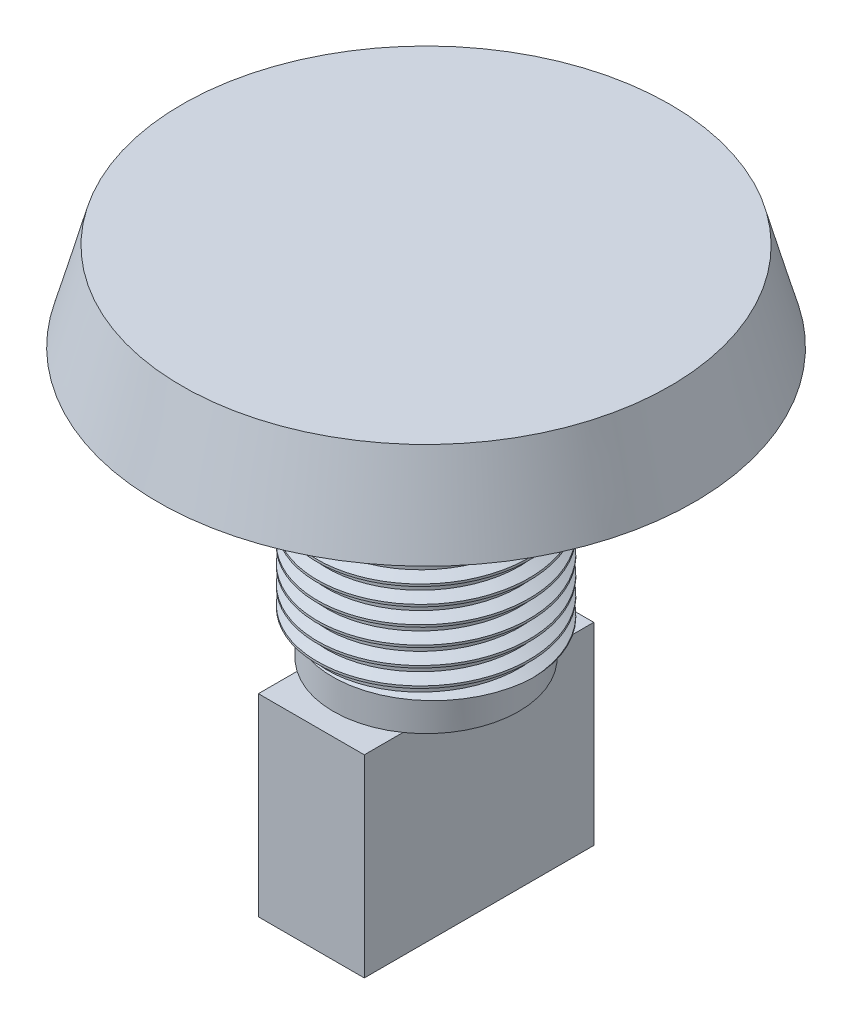
from build123d import *

# Parameters (mm, degrees)
SKETCH2_R           = 12
BOSS_EXTRUDE1_DEPTH = 30.5
THREAD1_PITCH       = 2
CUT_EXTRUDE1_START  = -4
SKETCH8_R           = 12
SKETCH8_R_2         = 10.5
CUT_EXTRUDE1_DEPTH  = 4
SKETCH9_W           = 12
SKETCH9_H           = 26
BOSS_EXTRUDE2_DEPTH = 21.9
SKETCH10_R          = 1.65
BOSS_EXTRUDE3_DEPTH = 4


with BuildPart() as part:
    # Sketch1 → Revolve1 (revolve)
    with BuildSketch(Plane.XY, mode=Mode.PRIVATE) as revolve1_sk:
        Polygon((0, 0), (0, 10), (-27.65, 10), (-30.4, 0), align=None)
    revolve(revolve1_sk.sketch.rotate(Axis((0, 0, 0), (0, 1, 0)), 270), axis=Axis((0, 0, 0), (0, 1, 0)))

    # Sketch2 → Boss-Extrude1 (add)
    with BuildSketch(Plane.XZ):
        with Locations(Location((0, 0, 0), (0, 0, 90))):
            Circle(SKETCH2_R)
    extrude(amount=BOSS_EXTRUDE1_DEPTH)

    # Thread1: arcs per turn and ends read off the stored shape
    # Thread1: the profile of Thread Profile1 profile screwed along a right-hand helix through 14.25 turns, 10 arcs to a turn; built about Z, then put on its axis
    thread1_z = Axis((0, 0, 0), (0, 0, 1))
    thread1_corners = [(12.0003, 0, -0.000173205), (12.0003, 0, 1.7501732), (10.91746825, 0, 1.124999997), (10.91746825, 0, 0.624999997)]
    with BuildLine(mode=Mode.PRIVATE) as thread1_profile:
        Line(thread1_corners[0], thread1_corners[1])
        Line(thread1_corners[1], thread1_corners[2])
        Line(thread1_corners[2], thread1_corners[3])
        Line(thread1_corners[3], thread1_corners[0])
    thread1_cap = Face(thread1_profile.wire())
    thread1_turn_angles = [0, 18, 36, 54, 72, 90, 108, 126, 144, 162, 180, 198, 216, 234, 252, 270, 288, 306, 324, 342, 360]
    thread1_turn_weights = [1, 0.9510565162951535, 1, 0.9510565162951535, 1, 0.9510565162951535, 1, 0.9510565162951535, 1, 0.9510565162951535, 1, 0.9510565162951535, 1, 0.9510565162951535, 1, 0.9510565162951535, 1, 0.9510565162951535, 1, 0.9510565162951535, 1]
    thread1_turn_rails = [Edge.make_bspline([Vector(p[0], p[1], 0).rotate(thread1_z, thread1_turn_angles[k]) / thread1_turn_weights[k] + Vector(0, 0, p[2] + THREAD1_PITCH * thread1_turn_angles[k] / 360) for k in range(21)], [0, 0, 0, 1, 1, 2, 2, 3, 3, 4, 4, 5, 5, 6, 6, 7, 7, 8, 8, 9, 9, 10, 10, 10], 2, thread1_turn_weights) for p in thread1_corners]
    thread1_turn_sides = [Face.make_surface_from_curves(thread1_turn_rails[p[0]], thread1_turn_rails[p[1]]) for p in [(0, 1), (1, 2), (2, 3), (3, 0)]]
    thread1_last_angles = [5040, 5058, 5076, 5094, 5112, 5121, 5130]
    thread1_last_weights = [1, 0.9510565162951535, 1, 0.9510565162951535, 1, 0.9876883405951378, 1]
    thread1_last_rails = [Edge.make_bspline([Vector(p[0], p[1], 0).rotate(thread1_z, thread1_last_angles[k]) / thread1_last_weights[k] + Vector(0, 0, p[2] + THREAD1_PITCH * thread1_last_angles[k] / 360) for k in range(7)], [0, 0, 0, 1, 1, 2, 2, 3, 3, 3], 2, thread1_last_weights) for p in thread1_corners]
    thread1_last_sides = [Face.make_surface_from_curves(thread1_last_rails[p[0]], thread1_last_rails[p[1]]) for p in [(0, 1), (1, 2), (2, 3), (3, 0)]]
    thread1 = Plane(origin=(0, -30.5, 0), x_dir=(1, 0, 0), z_dir=(0, 1, 0)) * Solid(Shell([*[p.moved(Location((0, 0, THREAD1_PITCH * i))) for i in range(14) for p in thread1_turn_sides], *thread1_last_sides, thread1_cap, thread1_cap.rotate(thread1_z, 5130).moved(Location((0, 0, THREAD1_PITCH * 5130 / 360)))]))
    add(thread1, mode=Mode.SUBTRACT)

    # Sketch8 → Cut-Extrude1 (cut)
    with BuildSketch(Plane.XZ.offset(30.5).offset(CUT_EXTRUDE1_START)):
        with Locations(Location((0, 0, 0), (0, 0, 270))):
            Circle(SKETCH8_R)
        with Locations(Location((0, 0, 0), (0, 0, 270))):
            Circle(SKETCH8_R_2, mode=Mode.SUBTRACT)
    extrude(amount=CUT_EXTRUDE1_DEPTH, mode=Mode.SUBTRACT)

    # Sketch9 → Boss-Extrude2 (add)
    with BuildSketch(Plane.XZ.offset(30.5)):
        Rectangle(SKETCH9_W, SKETCH9_H)
    extrude(amount=BOSS_EXTRUDE2_DEPTH)

    # Sketch10 → Boss-Extrude3 (add)
    with BuildSketch(Plane.XZ):
        with Locations(Location((0, -18.85, 0), (0, 0, 90))):
            Circle(SKETCH10_R)
        with Locations(Location((0, 18.85, 0), (0, 0, 90))):
            Circle(SKETCH10_R)
    extrude(amount=BOSS_EXTRUDE3_DEPTH)


solid = part.part
